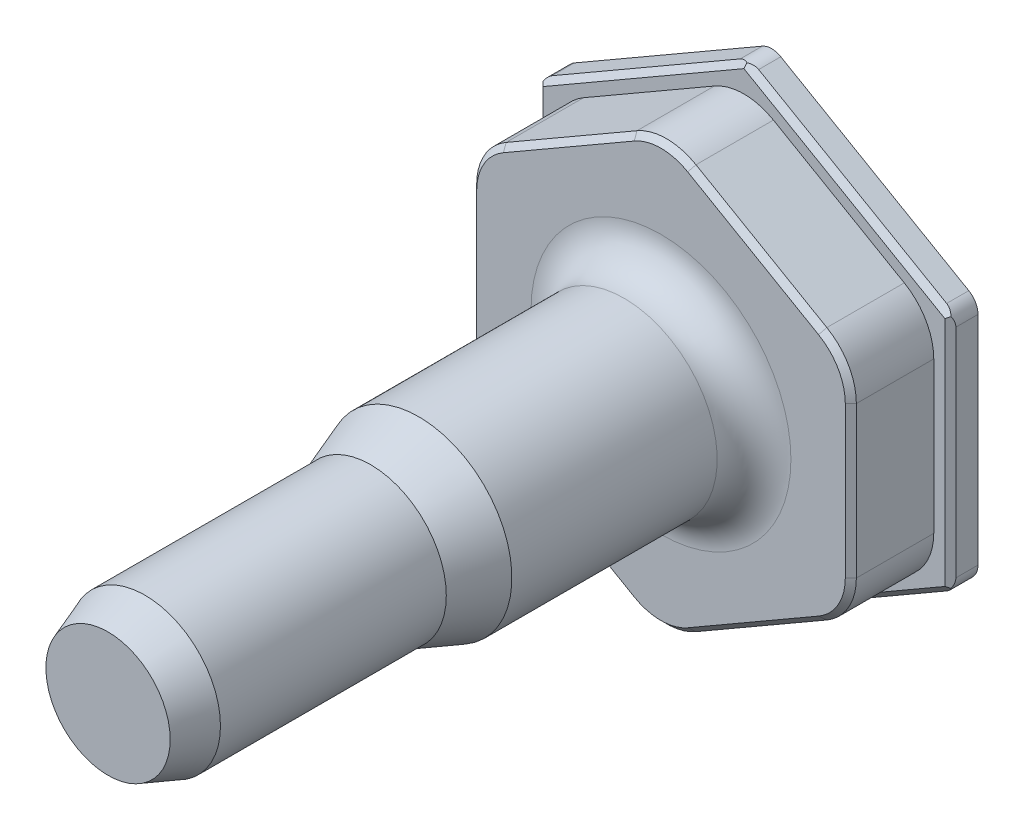
from build123d import *

# Parameters (mm, degrees)
BOSS_EXTRUDE1_DEPTH  = 1.5
SKETCH1_8_R          = 4.1
BOSS_EXTRUDE3_DEPTH  = 36
SKETCH1_9_R          = 5.05
BOSS_EXTRUDE4_DEPTH  = 19
SHELL1_START         = 2
SHELL1_OUTLINE_R     = 2.1
SHELL1_DEPTH         = 32
SHELL1_2_OUTLINE_R   = 3.05
SHELL1_2_OUTLINE_R_2 = 2.1
SHELL1_2_DEPTH       = 15
SKETCH1_10_R         = 3.25
CUT_EXTRUDE1_DEPTH   = 17
SKETCH1_3_R          = 3.25
BOSS_EXTRUDE2_DEPTH  = 6
CHAMFER1_SIZE        = 2
CHAMFER1_SIZE2       = 0.727940469
CHAMFER2_SIZE        = 2.747477419
CHAMFER2_SIZE_2      = 1
CHAMFER3_SIZE        = 1.212435565
CHAMFER3_SIZE_2      = 0.7
CHAMFER6_SIZE        = 0.3
FILLET1_R            = 3.2
CHAMFER5_SIZE        = 0.3
FILLET2_R            = 1
FILLET3_R            = 2


# Read off the part's stored shape, not the designer's step: Shell1
with BuildPart() as part:
    # Sketch1 → Boss-Extrude1 (new body)
    with BuildSketch(Plane.XY):
        Polygon((-11.2, 6.466323015), (0, 12.93264603), (11.2, 6.466323015), (11.2, -6.466323015), (0, -12.93264603), (-11.2, -6.466323015), align=None)
    extrude(amount=BOSS_EXTRUDE1_DEPTH)

    # Sketch1<8> → Boss-Extrude3 (add)
    with BuildSketch(Plane.XY):
        with Locations(Location((0, 0, 0), (0, 0, 180))):
            Circle(SKETCH1_8_R)
    extrude(amount=BOSS_EXTRUDE3_DEPTH)

    # Sketch1<9> → Boss-Extrude4 (add)
    with BuildSketch(Plane.XY):
        with Locations(Location((0, 0, 0), (0, 0, 180))):
            Circle(SKETCH1_9_R)
    extrude(amount=BOSS_EXTRUDE4_DEPTH)

    # Shell1 outline → Shell1 (cut)
    with BuildSketch(Plane.XY.offset(SHELL1_START)):
        Circle(SHELL1_OUTLINE_R)
    extrude(amount=SHELL1_DEPTH, mode=Mode.SUBTRACT)

    # Shell1 2 outline → Shell1 2 (cut)
    with BuildSketch(Plane.XY.offset(SHELL1_START)):
        Circle(SHELL1_2_OUTLINE_R)
        Circle(SHELL1_2_OUTLINE_R_2, mode=Mode.SUBTRACT)
    extrude(amount=SHELL1_2_DEPTH, mode=Mode.SUBTRACT)

    # Sketch1<10> → Cut-Extrude1 (cut)
    with BuildSketch(Plane.XY):
        Circle(SKETCH1_10_R)
    extrude(amount=CUT_EXTRUDE1_DEPTH, mode=Mode.SUBTRACT)

    # Sketch1<3> → Boss-Extrude2 (add)
    with BuildSketch(Plane.XY):
        Polygon((0, 11.893415545), (10.3, 5.946707773), (10.3, -5.946707773), (0, -11.893415545), (-10.3, -5.946707773), (-10.3, 5.946707773), align=None)
        Circle(SKETCH1_3_R, mode=Mode.SUBTRACT)
    extrude(amount=BOSS_EXTRUDE2_DEPTH)

    # Chamfer1
    chamfer1_edges = [part.edges().sort_by_distance(p)[0] for p in [
        (4.1, 0, 36),
    ]]
    chamfer1_side = [part.faces().sort_by_distance(p)[0] for p in [
        (4.1, 0, 27.5),
    ]]
    chamfer(chamfer1_edges, length=CHAMFER1_SIZE, length2=CHAMFER1_SIZE2, reference=chamfer1_side[0])

    # Chamfer2
    # the kernel refuses this chamfer: 2.747477419, 1 mm, written as the material it adds along each edge
    with BuildSketch(Plane(origin=(0, 0, 19), x_dir=(-1, 0, 0), z_dir=(0, -1, 0))) as chamfer2_piece_1_section:
        Polygon((4.1, -CHAMFER2_SIZE), (4.1 + CHAMFER2_SIZE_2, 0), (4.1, 0), align=None)
    chamfer2_piece_1 = revolve(axis=Axis((0, 0, 19), (0, 0, -1)), mode=Mode.PRIVATE)
    chamfer2_piece_1 = chamfer2_piece_1 & Plane(origin=(0, 0, 20.481947897), x_dir=(-1, 0, 0), z_dir=(0, 0, -1)) * Cylinder(5.05, 21, mode=Mode.PRIVATE)
    add(chamfer2_piece_1)

    # Chamfer3
    # the kernel refuses this chamfer: 1.212435565, 0.7 mm, written as the material it takes off along each edge
    with BuildSketch(Plane(origin=(0, 0, 17), x_dir=(1, 0, 0), z_dir=(0, -1, 0))) as chamfer3_piece_1_section:
        Polygon((2.1 + CHAMFER3_SIZE, 0), (2.1, CHAMFER3_SIZE_2), (2.1, 0), align=None)
    chamfer3_piece_1 = revolve(axis=Axis((0, 0, 17), (0, 0, 1)), mode=Mode.PRIVATE)
    chamfer3_piece_1 = chamfer3_piece_1 & Plane(origin=(0, 0, 17.363214185), x_dir=(1, 0, 0), z_dir=(0, 0, -1)) * Cylinder(3.25, 14, mode=Mode.PRIVATE)
    add(chamfer3_piece_1, mode=Mode.SUBTRACT)

    # Chamfer6
    chamfer6_edges = [part.edges().sort_by_distance(p)[0] for p in [
        (-3.25, 0, 0),
    ]]
    chamfer(chamfer6_edges, length=CHAMFER6_SIZE)

    # Fillet1
    fillet1_edges = [part.edges().sort_by_distance(p)[0] for p in [
        (-10.3, -5.946707773, 3.75),
        (0, -11.893415545, 3.75),
        (10.3, -5.946707773, 3.75),
        (10.3, 5.946707773, 3.75),
        (0, 11.893415545, 3.75),
        (-10.3, 5.946707773, 3.75),
    ]]
    fillet(fillet1_edges, radius=FILLET1_R)

    # Chamfer5
    chamfer5_edges = [part.edges().sort_by_distance(p)[0] for p in [
        (-5.15, -8.920061659, 6),
        (5.15, 8.920061659, 6),
        (-5.15, 8.920061659, 6),
        (-10.3, 0, 6),
        (9.871281292, 5.699186911, 6),
        (0, 11.398373822, 6),
        (-9.871281292, 5.699186911, 6),
        (-9.871281292, -5.699186911, 6),
        (0, -11.398373822, 6),
        (9.871281292, -5.699186911, 6),
        (5.6, 9.699484522, 1.5),
        (11.2, 0, 1.5),
        (5.6, -9.699484522, 1.5),
        (-5.6, -9.699484522, 1.5),
        (-11.2, 0, 1.5),
        (-5.6, 9.699484522, 1.5),
        (10.3, 0, 6),
        (5.15, -8.920061659, 6),
    ]]
    chamfer(chamfer5_edges, length=CHAMFER5_SIZE)

    # Fillet2
    fillet2_edges = [part.edges().sort_by_distance(p)[0] for p in [
        (11.2, 6.466323015, 0.6),
        (11.2, -6.466323015, 0.6),
        (0, -12.93264603, 0.6),
        (-11.2, -6.466323015, 0.6),
        (-11.2, 6.466323015, 0.6),
        (0, 12.93264603, 0.6),
    ]]
    fillet(fillet2_edges, radius=FILLET2_R)

    # Fillet3
    fillet3_edges = [part.edges().sort_by_distance(p)[0] for p in [
        (5.05, 0, 6),
    ]]
    fillet(fillet3_edges, radius=FILLET3_R)


solid = part.part
